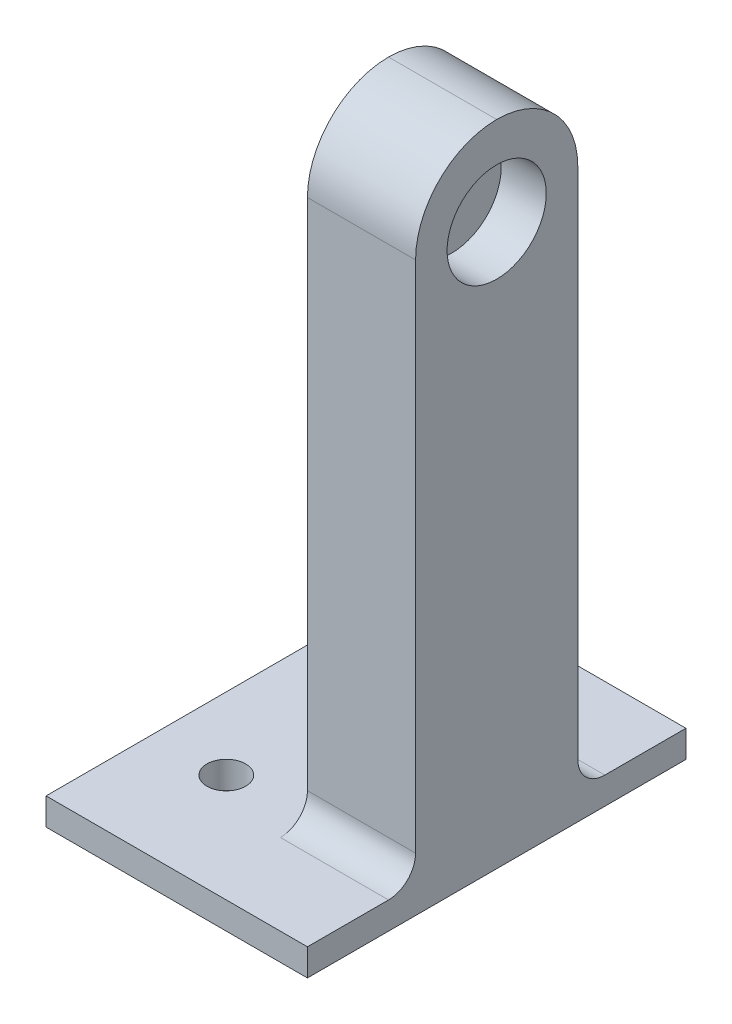
from build123d import *

# Parameters (mm, degrees)
SKETCH1_W            = 94
SKETCH1_H            = 42
BOSS_EXTRUDE1_DEPTH  = 3
SKETCH2_W            = 4
SKETCH2_H            = 42
BOSS_EXTRUDE2_DEPTH  = 47
SKETCH3_R            = 12.5
SKETCH3_R_2          = 1.6
CUT_EXTRUDE1_DEPTH   = 114.176852757
SKETCH4_W            = 42
SKETCH4_H            = 5
BOSS_EXTRUDE3_DEPTH  = 40
SKETCH5_W            = 42
SKETCH5_H            = 5
BOSS_EXTRUDE4_DEPTH  = 38
SKETCH7_W            = 42
SKETCH7_H            = 42
SKETCH7_W_2          = 44
BOSS_EXTRUDE6_DEPTH  = 5
SKETCH9_R            = 2.15
CUT_EXTRUDE2_DEPTH   = 149.731301346
SKETCH11_W           = 10
SKETCH11_H           = 18
BOSS_EXTRUDE7_DEPTH  = 20
SKETCH13_R           = 5.5
CUT_EXTRUDE3_DEPTH   = 169.988165266
BOSS_EXTRUDE11_DEPTH = 5
SKETCH23_W           = 10
SKETCH23_H           = 26
BOSS_EXTRUDE12_DEPTH = 50
CUT_EXTRUDE7_DEPTH   = 193.595430891
SKETCH25_W           = 10
SKETCH25_H           = 18
BOSS_EXTRUDE13_DEPTH = 20
SKETCH26_R           = 5.5
CUT_EXTRUDE8_DEPTH   = 193.595430891
SKETCH27_W           = 12
SKETCH27_H           = 18
BOSS_EXTRUDE14_DEPTH = 69
CUT_EXTRUDE10_START  = -5
SKETCH28_R           = 5.5
CUT_EXTRUDE10_DEPTH  = 5
SKETCH29_R           = 5.5
CUT_EXTRUDE11_DEPTH  = 5
FILLET4_R            = 9
FILLET3_R            = 3
SKETCH30_W           = 60
SKETCH30_H           = 42
SKETCH30_W_2         = 81
SKETCH30_H_2         = 100
CUT_EXTRUDE12_DEPTH  = 181.413414135
SKETCH31_W           = 2
SKETCH31_H           = 42
CUT_EXTRUDE13_DEPTH  = 10


# Some blends are built 0.0001 mm under size
with BuildPart() as part:
    # Sketch1 → Boss-Extrude1 (new body)
    with BuildSketch(Plane(origin=(0, 0, 0), x_dir=(1, 0, 0), z_dir=(0, 1, 0))):
        with Locations((47, -21)):
            Rectangle(SKETCH1_W, SKETCH1_H)
    extrude(amount=BOSS_EXTRUDE1_DEPTH)

    # Sketch2 → Boss-Extrude2 (add)
    with BuildSketch(Plane.XZ):
        with Locations((2, 21)):
            Rectangle(SKETCH2_W, SKETCH2_H)
        with Locations((92, 21)):
            Rectangle(SKETCH2_W, SKETCH2_H)
    extrude(amount=-BOSS_EXTRUDE2_DEPTH)

    # Sketch3 → Cut-Extrude1 (cut, through all)
    with BuildSketch(Plane(origin=(94, 0, 0), x_dir=(0, 0, -1), z_dir=(1, 0, 0))):
        with Locations((-21, 26)):
            Circle(SKETCH3_R)
        with Locations((-36.5, 41.5)):
            Circle(SKETCH3_R_2)
        with Locations((-5.5, 41.5)):
            Circle(SKETCH3_R_2)
        with Locations((-36.5, 10.5)):
            Circle(SKETCH3_R_2)
        with Locations((-5.5, 10.5)):
            Circle(SKETCH3_R_2)
    extrude(amount=-CUT_EXTRUDE1_DEPTH, mode=Mode.SUBTRACT)

    # Sketch4 → Boss-Extrude3 (add)
    with BuildSketch(Plane(origin=(94, 0, 0), x_dir=(0, 0, -1), z_dir=(1, 0, 0))):
        with Locations((-21, 2.5)):
            Rectangle(SKETCH4_W, SKETCH4_H)
    extrude(amount=BOSS_EXTRUDE3_DEPTH)

    # Sketch5 → Boss-Extrude4 (add)
    with BuildSketch(Plane.ZY):
        with Locations((21, 2.5)):
            Rectangle(SKETCH5_W, SKETCH5_H)
    extrude(amount=BOSS_EXTRUDE4_DEPTH)

    # Sketch7 → Boss-Extrude6 (add)
    with BuildSketch(Plane(origin=(0, 47, 0), x_dir=(1, 0, 0), z_dir=(0, 1, 0))):
        with Locations((-17, -21)):
            Rectangle(SKETCH7_W, SKETCH7_H)
        with Locations((112, -21)):
            Rectangle(SKETCH7_W_2, SKETCH7_H)
    extrude(amount=BOSS_EXTRUDE6_DEPTH)

    # Sketch9 → Cut-Extrude2 (cut, through all)
    with BuildSketch(Plane(origin=(0, 3, 0), x_dir=(1, 0, 0), z_dir=(0, 1, 0))):
        with Locations(Location((83, -20, 0), (0, 0, 270))):
            Circle(SKETCH9_R)
        with Locations(Location((65, -20, 0), (0, 0, 270))):
            Circle(SKETCH9_R)
        with Locations(Location((74, -11, 0), (0, 0, 270))):
            Circle(SKETCH9_R)
        with Locations(Location((74, -29, 0), (0, 0, 270))):
            Circle(SKETCH9_R)
        with Locations(Location((16, -12, 0), (0, 0, 270))):
            Circle(SKETCH9_R)
        with Locations(Location((16, -30, 0), (0, 0, 270))):
            Circle(SKETCH9_R)
        with Locations(Location((32, -12, 0), (0, 0, 270))):
            Circle(SKETCH9_R)
        with Locations(Location((32, -30, 0), (0, 0, 270))):
            Circle(SKETCH9_R)
    extrude(amount=-CUT_EXTRUDE2_DEPTH, mode=Mode.SUBTRACT)

    # Sketch11 → Boss-Extrude7 (add)
    with BuildSketch(Plane(origin=(0, 52, 0), x_dir=(1, 0, 0), z_dir=(0, 1, 0))):
        with Locations((-8, -21)):
            Rectangle(SKETCH11_W, SKETCH11_H)
        with Locations((107, -21)):
            Rectangle(SKETCH11_W, SKETCH11_H)
    extrude(amount=BOSS_EXTRUDE7_DEPTH)

    # Sketch13 → Cut-Extrude3 (cut, through all)
    with BuildSketch(Plane.ZY.offset(13)):
        with Locations((21, 62.15)):
            Circle(SKETCH13_R)
    extrude(amount=-CUT_EXTRUDE3_DEPTH, mode=Mode.SUBTRACT)

    # Sketch20 → Boss-Extrude11 (add)
    with BuildSketch(Plane.XY.offset(42)):
        Polygon((134, 0), (134, 52), (90, 52), (90, 0), (95, 0), (95, 20), (102, 26), (112, 26), (129, 20), (129, 0), align=None)
    extrude(amount=BOSS_EXTRUDE11_DEPTH)

    # Sketch23 → Boss-Extrude12 (add)
    with BuildSketch(Plane.XY.offset(47)):
        with Locations((107, 39)):
            Rectangle(SKETCH23_W, SKETCH23_H)
    extrude(amount=BOSS_EXTRUDE12_DEPTH)

    # Sketch24 → Cut-Extrude7 (cut, through all)
    with BuildSketch(Plane(origin=(112, 0, 0), x_dir=(0, 0, -1), z_dir=(1, 0, 0))):
        Polygon((-47, 26), (-97, 39), (-97, 26), align=None)
    extrude(amount=-CUT_EXTRUDE7_DEPTH, mode=Mode.SUBTRACT)

    # Sketch25 → Boss-Extrude13 (add)
    with BuildSketch(Plane(origin=(0, 52, 0), x_dir=(1, 0, 0), z_dir=(0, 1, 0))):
        with Locations((107, -71)):
            Rectangle(SKETCH25_W, SKETCH25_H)
    extrude(amount=BOSS_EXTRUDE13_DEPTH)

    # Sketch26 → Cut-Extrude8 (cut, through all)
    with BuildSketch(Plane(origin=(112, 0, 0), x_dir=(0, 0, -1), z_dir=(1, 0, 0))):
        with Locations((-71, 62.15)):
            Circle(SKETCH26_R)
    extrude(amount=-CUT_EXTRUDE8_DEPTH, mode=Mode.SUBTRACT)

    # Sketch27 → Boss-Extrude14 (add)
    with BuildSketch(Plane(origin=(0, 3, 0), x_dir=(1, 0, 0), z_dir=(0, 1, 0))):
        with Locations((47, -21)):
            Rectangle(SKETCH27_W, SKETCH27_H)
    extrude(amount=BOSS_EXTRUDE14_DEPTH)

    # Sketch28 → Cut-Extrude10 (cut)
    with BuildSketch(Plane(origin=(53, 0, 0), x_dir=(0, 0, -1), z_dir=(1, 0, 0)).offset(CUT_EXTRUDE10_START)):
        with Locations(Location((-21, 62.15, 0), (0, 0, 180))):
            Circle(SKETCH28_R)
    extrude(amount=CUT_EXTRUDE10_DEPTH, mode=Mode.SUBTRACT)

    # Sketch29 → Cut-Extrude11 (cut)
    with BuildSketch(Plane.ZY.offset(-41)):
        with Locations((21, 62.15)):
            Circle(SKETCH29_R)
    extrude(amount=-CUT_EXTRUDE11_DEPTH, mode=Mode.SUBTRACT)

    # Fillet4
    fillet4_edges = [part.edges().sort_by_distance(p)[0] for p in [
        (-8, 72, 12),
        (-8, 72, 30),
        (107, 72, 12),
        (107, 72, 30),
        (107, 72, 62),
        (107, 72, 80),
        (47, 72, 12),
        (47, 72, 30),
    ]]
    fillet(fillet4_edges, radius=FILLET4_R - 0.0001)  # a hair under: the kernel refuses the full size

    # Fillet3
    # the kernel refuses this fillet: 3 mm, written as the material it adds along each edge
    with BuildSketch(Plane(origin=(-3, 52, 30), x_dir=(0, 1, 0), z_dir=(-1, 0, 0)), Plane(origin=(112, 52, 80), x_dir=(0, 1, 0), z_dir=(-1, 0, 0))) as fillet3_piece_1:
        with BuildLine():
            CenterArc((FILLET3_R, -FILLET3_R), FILLET3_R, 90, 90)
            Line((0, -FILLET3_R), (0, 0))
            Line((0, 0), (FILLET3_R, 0))
        make_face()
    extrude(amount=10)
    with BuildSketch(Plane(origin=(-13, 52, 12), x_dir=(0, 0, -1), z_dir=(1, 0, 0)), Plane(origin=(112, 52, 30), x_dir=(0, 0, 1), z_dir=(-1, 0, 0)), Plane(origin=(102, 52, 12), x_dir=(0, 0, -1), z_dir=(1, 0, 0)), Plane(origin=(102, 52, 62), x_dir=(0, 0, -1), z_dir=(1, 0, 0))) as fillet3_piece_2:
        with BuildLine():
            CenterArc((FILLET3_R, FILLET3_R), FILLET3_R, 180, 90)
            Line((0, FILLET3_R), (0, 0))
            Line((0, 0), (FILLET3_R, 0))
        make_face()
    extrude(amount=10)
    with BuildSketch(Plane(origin=(95, 20, 42), x_dir=(0, -1, 0), z_dir=(0, 0, 1))) as fillet3_piece_3:
        with BuildLine():
            CenterArc((FILLET3_R * 0.45993492247, FILLET3_R), FILLET3_R, 220.601294645, 49.398705355)
            Line((-FILLET3_R * 0.299321679895, FILLET3_R * 0.349208626544), (0, 0))
            Line((0, 0), (FILLET3_R * 0.45993492247, 0))
        make_face()
    extrude(amount=5)
    with BuildSketch(Plane(origin=(102, 26, 42), x_dir=(-0.7592566023652966, -0.6507913734559685, 0), z_dir=(0, 0, 1))) as fillet3_piece_4:
        with BuildLine():
            CenterArc((FILLET3_R * 0.369924076215, FILLET3_R), FILLET3_R, 229.398705355, 40.601294645)
            Line((-FILLET3_R * 0.28086729724, FILLET3_R * 0.240743397635), (0, 0))
            Line((0, 0), (FILLET3_R * 0.369924076215, 0))
        make_face()
    extrude(amount=5)
    with BuildSketch(Plane(origin=(112, 26, 42), x_dir=(0.942990333582889, -0.3328201177351389, 0), z_dir=(0, 0, 1))) as fillet3_piece_5:
        with BuildLine():
            CenterArc((FILLET3_R * 0.171292729553, -FILLET3_R), FILLET3_R, 90, 19.440034828)
            Line((-FILLET3_R * 0.161527388182, -FILLET3_R * 0.0570096664171), (0, 0))
            Line((0, 0), (FILLET3_R * 0.171292729553, 0))
        make_face()
    extrude(amount=5)
    with BuildSketch(Plane(origin=(129, 20, 42), x_dir=(0, -1, 0), z_dir=(0, 0, 1))) as fillet3_piece_6:
        with BuildLine():
            CenterArc((FILLET3_R * 0.707515081019, -FILLET3_R), FILLET3_R, 90, 70.559965172)
            Line((-FILLET3_R * 0.235475252564, -FILLET3_R * 0.667179882265), (0, 0))
            Line((0, 0), (FILLET3_R * 0.707515081019, 0))
        make_face()
    extrude(amount=5)
    with BuildSketch(Plane(origin=(53, 3, 30), x_dir=(0, 0, 1), z_dir=(-1, 0, 0)), Plane(origin=(41, 3, 12), x_dir=(0, 0, -1), z_dir=(1, 0, 0))) as fillet3_piece_7:
        with BuildLine():
            CenterArc((FILLET3_R, FILLET3_R), FILLET3_R, 180, 90)
            Line((0, FILLET3_R), (0, 0))
            Line((0, 0), (FILLET3_R, 0))
        make_face()
    extrude(amount=12)
    # the kernel refuses this fillet: 3 mm, written as the material it takes off along each edge
    with BuildSketch(Plane(origin=(94.5, 52, 97), x_dir=(0, 0, -1), z_dir=(1, 0, 0))) as fillet3_2_piece_1:
        with BuildLine():
            CenterArc((FILLET3_R, -FILLET3_R), FILLET3_R, 90, 90)
            Line((0, -FILLET3_R), (0, 0))
            Line((0, 0), (FILLET3_R, 0))
        make_face()
    extrude(amount=25, mode=Mode.SUBTRACT)
    with BuildSketch(Plane(origin=(117.799354812, 39, 97), x_dir=(0, -0.25163385176495195, -0.9678225067882716), z_dir=(-1, 0, 0))) as fillet3_2_piece_2:
        with BuildLine():
            CenterArc((FILLET3_R * 0.773247308247, -FILLET3_R), FILLET3_R, 90, 75.425783802)
            Line((-FILLET3_R * 0.194575198541, -FILLET3_R * 0.748366148235), (0, 0))
            Line((0, 0), (FILLET3_R * 0.773247308247, 0))
        make_face()
    extrude(amount=21.598709624, mode=Mode.SUBTRACT)

    # Sketch30 → Cut-Extrude12 (cut, through all)
    with BuildSketch(Plane.XZ):
        with Locations((-8, 21)):
            Rectangle(SKETCH30_W, SKETCH30_H)
        with Locations((93.5, 50)):
            Rectangle(SKETCH30_W_2, SKETCH30_H_2)
    extrude(amount=-CUT_EXTRUDE12_DEPTH, mode=Mode.SUBTRACT)

    # Sketch31 → Cut-Extrude13 (cut)
    with BuildSketch(Plane(origin=(0, 3, 0), x_dir=(1, 0, 0), z_dir=(0, 1, 0))):
        with Locations((23, -21)):
            Rectangle(SKETCH31_W, SKETCH31_H)
    extrude(amount=-CUT_EXTRUDE13_DEPTH, mode=Mode.SUBTRACT)


solid = part.part
